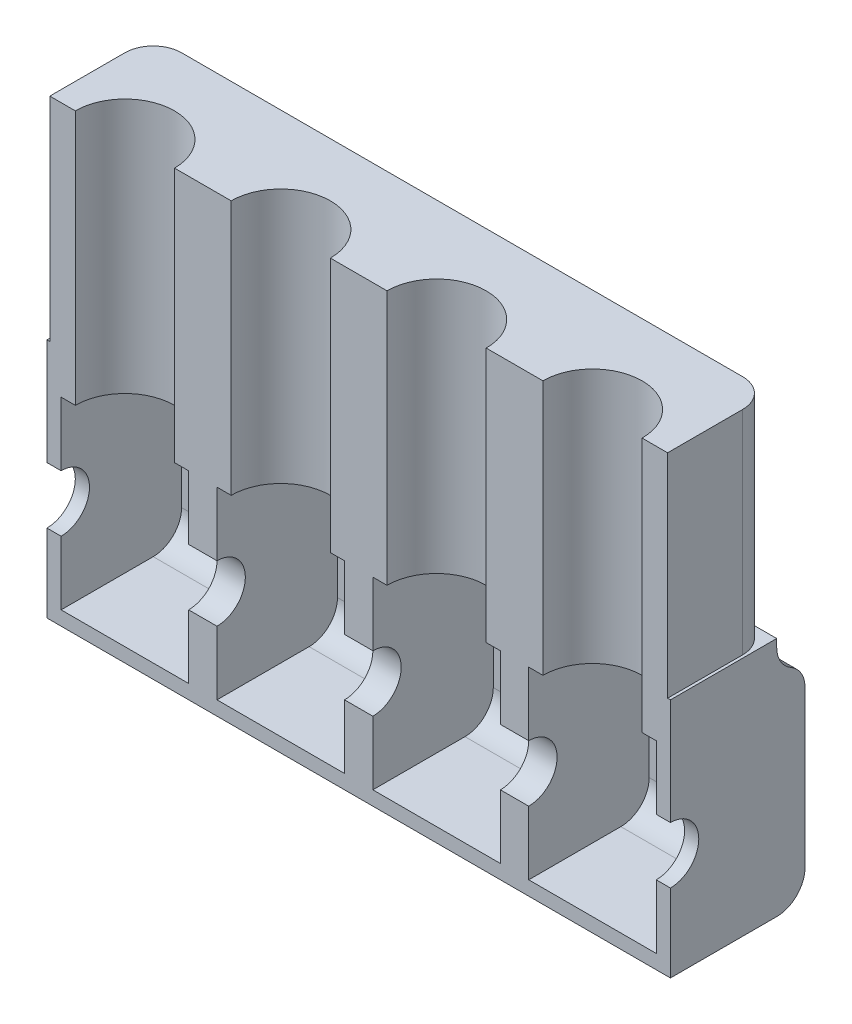
from build123d import *

# Parameters (mm, degrees)
SKETCH5_W              = 55
SKETCH5_H              = 150
BOSS_EXTRUDE3_DEPTH    = 55
SKETCH7_W              = 55
SKETCH7_H              = 27.5
CUT_EXTRUDE5_DEPTH     = 195
SKETCH10_W             = 55
SKETCH10_H             = 150
BOSS_EXTRUDE4_DEPTH    = 10
SKETCH13_W             = 55
SKETCH13_H             = 75
BOSS_EXTRUDE6_DEPTH    = 10
FILLET1_R              = 10
FILLET2_R              = 10
SKETCH15_W             = 45
SKETCH15_H             = 65
CUT_EXTRUDE9_DEPTH     = 42.5
SKETCH6_R              = 17.5
CUT_EXTRUDE11_DEPTH    = 91.5
FILLET3_R              = 10
SKETCH18_R             = 15
SKETCH18_R_2           = 10
BOSS_EXTRUDE7_DEPTH    = 15
CUT_EXTRUDE14_START    = -74
SKETCH20_R             = 10
CUT_EXTRUDE14_DEPTH    = 74
CUT_EXTRUDE16_DEPTH    = 39
CUT_EXTRUDE18_START    = -15
CUT_EXTRUDE18_DEPTH    = 15
FILLET1_OF_MIRROR11_R  = 10
FILLET2_OF_MIRROR11_R  = 10
FILLET3_OF_MIRROR11_R  = 10
CUT_EXTRUDE19_DEPTH    = 15
CUT_EXTRUDE20_START    = -10
CUT_EXTRUDE20_DEPTH    = 10
MIRROR31_START         = 155
MIRROR31_DEPTH         = 65
MIRROR31_START_2       = 110
MIRROR31_2_DEPTH       = 10
MIRROR31_START_3       = 160
MIRROR31_3_DEPTH       = 10
MIRROR31_4_DEPTH       = 5
MIRROR31_START_4       = 215
MIRROR31_5_DEPTH       = 5
MIRROR31_START_5       = 150
MIRROR31_6_OUTLINE_R   = 15
MIRROR31_6_OUTLINE_R_2 = 10
MIRROR31_6_DEPTH       = 15
MIRROR31_START_6       = 120
MIRROR31_7_DEPTH       = 35
MIRROR31_START_7       = -80
MIRROR31_8_DEPTH       = 80
CUT_EXTRUDE22_START    = -36
CUT_EXTRUDE22_DEPTH    = 36
CUT_EXTRUDE23_DEPTH    = 10
SKETCH40_W             = 1
SKETCH40_H             = 36.5
CUT_EXTRUDE25_DEPTH    = 65
FILLET4_R              = 10
BOSS_EXTRUDE8_DEPTH    = 10


with BuildPart() as part:
    # Sketch5 → Boss-Extrude3 (new body)
    with BuildSketch(Plane.XY):
        with Locations((27.5, -75)):
            Rectangle(SKETCH5_W, SKETCH5_H)
    boss_extrude3 = extrude(amount=BOSS_EXTRUDE3_DEPTH)

    # Sketch7 → Cut-Extrude5 (cut)
    with BuildSketch(Plane(origin=(0, 0, 0), x_dir=(1, 0, 0), z_dir=(0, 1, 0))):
        with Locations((27.5, -41.25)):
            Rectangle(SKETCH7_W, SKETCH7_H)
    cut_extrude5 = extrude(amount=-CUT_EXTRUDE5_DEPTH, mode=Mode.SUBTRACT)

    # Sketch10 → Boss-Extrude4 (add)
    with BuildSketch(Plane(origin=(0, 0, 0), x_dir=(-1, 0, 0), z_dir=(0, 0, -1))):
        with Locations((-27.5, -75)):
            Rectangle(SKETCH10_W, SKETCH10_H)
    boss_extrude4 = extrude(amount=BOSS_EXTRUDE4_DEPTH)

    # Sketch13 → Boss-Extrude6 (add)
    with BuildSketch(Plane(origin=(0, 0, -10), x_dir=(-1, 0, 0), z_dir=(0, 0, -1))):
        with Locations((-27.5, -112.5)):
            Rectangle(SKETCH13_W, SKETCH13_H)
    boss_extrude6 = extrude(amount=BOSS_EXTRUDE6_DEPTH)

    # Fillet1
    fillet1_edges = [part.edges().sort_by_distance(p)[0] for p in [
        (27.5, -150, -20),
        (27.5, -75, -20),
    ]]
    fillet(fillet1_edges, radius=FILLET1_R - 0.0001)  # a hair under: the kernel refuses the full size

    # Fillet2
    fillet2_edges = [part.edges().sort_by_distance(p)[0] for p in [
        (27.5, -75, -10),
    ]]
    fillet(fillet2_edges, radius=FILLET2_R)

    # Sketch15 → Cut-Extrude9 (cut)
    with BuildSketch(Plane.XY.offset(27.5)):
        with Locations((27.5, -112.5)):
            Rectangle(SKETCH15_W, SKETCH15_H)
    cut_extrude9 = extrude(amount=-CUT_EXTRUDE9_DEPTH, mode=Mode.SUBTRACT)

    # Sketch6 → Cut-Extrude11 (cut)
    with BuildSketch(Plane(origin=(0, 0, 0), x_dir=(1, 0, 0), z_dir=(0, 1, 0))):
        with Locations((27.5, -27.5)):
            Circle(SKETCH6_R)
    cut_extrude11 = extrude(amount=-CUT_EXTRUDE11_DEPTH, mode=Mode.SUBTRACT)

    # Fillet3
    fillet3_edges = [part.edges().sort_by_distance(p)[0] for p in [
        (27.5, -145, -15),
        (27.5, -80, -15),
    ]]
    fillet(fillet3_edges, radius=FILLET3_R)

    # Sketch18 → Boss-Extrude7 (add)
    with BuildSketch(Plane(origin=(55, 0, 0), x_dir=(0, 0, -1), z_dir=(1, 0, 0))):
        with Locations(Location((-27.5, -112.5, 0), (0, 0, 90))):
            Circle(SKETCH18_R)
        with Locations(Location((-27.5, -112.5, 0), (0, 0, 90))):
            Circle(SKETCH18_R_2, mode=Mode.SUBTRACT)
    boss_extrude7 = extrude(amount=BOSS_EXTRUDE7_DEPTH)

    # Sketch20 → Cut-Extrude14 (cut)
    with BuildSketch(Plane(origin=(55, 0, 0), x_dir=(0, 0, -1), z_dir=(1, 0, 0)).offset(CUT_EXTRUDE14_START)):
        with Locations(Location((-27.5, -112.5, 0), (0, 0, 90))):
            Circle(SKETCH20_R)
    cut_extrude14 = extrude(amount=CUT_EXTRUDE14_DEPTH, mode=Mode.SUBTRACT)

    # Sketch31 → Cut-Extrude16 (cut)
    with BuildSketch(Plane.ZY.offset(-55)):
        with BuildLine():
            Line((27.5, -97.5), (27.5, -102.5))
            ThreePointArc((27.5, -102.5), (37.5, -112.5), (27.5, -122.5))
            Line((27.5, -122.5), (27.5, -127.5))
            ThreePointArc((27.5, -127.5), (42.5, -112.5), (27.5, -97.5))
        make_face()
    extrude(amount=-CUT_EXTRUDE16_DEPTH, mode=Mode.SUBTRACT)

    # Sketch33 → Cut-Extrude18 (cut)
    with BuildSketch(Plane(origin=(70, 0, 0), x_dir=(0, 0, -1), z_dir=(1, 0, 0)).offset(CUT_EXTRUDE18_START)):
        with BuildLine():
            Line((-27.5, -97.5), (-27.5, -102.5))
            ThreePointArc((-27.5, -102.5), (-17.5, -112.5), (-27.5, -122.5))
            Line((-27.5, -122.5), (-27.5, -127.5))
            ThreePointArc((-27.5, -127.5), (-12.5, -112.5), (-27.5, -97.5))
        make_face()
    extrude(amount=CUT_EXTRUDE18_DEPTH, mode=Mode.SUBTRACT)


with BuildPart() as mirror11_1:
    # Mirror11: Boss-Extrude3 across plane
    add(boss_extrude3.mirror(Plane(origin=(55, 0, 0), x_dir=(0, 0, 1), z_dir=(1, 0, 0))))

    # Mirror11 2: Cut-Extrude5 across plane
    add(cut_extrude5.mirror(Plane(origin=(55, 0, 0), x_dir=(0, 0, 1), z_dir=(1, 0, 0))), mode=Mode.SUBTRACT)


with BuildPart() as mirror11_3_1:
    # Mirror11 3: Boss-Extrude4, Boss-Extrude6 across plane
    add(boss_extrude4.mirror(Plane(origin=(55, 0, 0), x_dir=(0, 0, 1), z_dir=(1, 0, 0))))
    add(boss_extrude6.mirror(Plane(origin=(55, 0, 0), x_dir=(0, 0, 1), z_dir=(1, 0, 0))))


with BuildPart() as mirror11_4_tool:
    # Mirror11 4: Cut-Extrude9, Cut-Extrude11 across plane
    add(cut_extrude9.mirror(Plane(origin=(55, 0, 0), x_dir=(0, 0, 1), z_dir=(1, 0, 0))))
    add(cut_extrude11.mirror(Plane(origin=(55, 0, 0), x_dir=(0, 0, 1), z_dir=(1, 0, 0))))


with BuildPart() as mirror11_1_1:
    add(mirror11_1.part)

    # Mirror11 4: cut by mirror11_4_tool
    add(mirror11_4_tool.part, mode=Mode.SUBTRACT)

    # Mirror11 6: Cut-Extrude14 across plane
    add(cut_extrude14.mirror(Plane(origin=(55, 0, 0), x_dir=(0, 0, 1), z_dir=(1, 0, 0))), mode=Mode.SUBTRACT)


with BuildPart() as mirror11_3_1_1:
    add(mirror11_3_1.part)

    # Mirror11 4: cut by mirror11_4_tool
    add(mirror11_4_tool.part, mode=Mode.SUBTRACT)

    # Fillet1 of Mirror11
    fillet1_of_mirror11_edges = [mirror11_3_1_1.edges().sort_by_distance(p)[0] for p in [
        (82.5, -150, -20),
        (82.5, -75, -20),
    ]]
    fillet(fillet1_of_mirror11_edges, radius=FILLET1_OF_MIRROR11_R - 0.0001)  # a hair under: the kernel refuses the full size

    # Fillet2 of Mirror11
    fillet2_of_mirror11_edges = [mirror11_3_1_1.edges().sort_by_distance(p)[0] for p in [
        (82.5, -75, -10),
    ]]
    fillet(fillet2_of_mirror11_edges, radius=FILLET2_OF_MIRROR11_R)

    # Fillet3 of Mirror11
    fillet3_of_mirror11_edges = [mirror11_3_1_1.edges().sort_by_distance(p)[0] for p in [
        (82.5, -145, -15),
        (82.5, -80, -15),
    ]]
    fillet(fillet3_of_mirror11_edges, radius=FILLET3_OF_MIRROR11_R)


with BuildPart() as mirror11_5_1:
    # Mirror11 5: Boss-Extrude7 across plane
    add(boss_extrude7.mirror(Plane(origin=(55, 0, 0), x_dir=(0, 0, 1), z_dir=(1, 0, 0))))


with BuildPart() as part_1:
    add(part.part)

    # Mirror11 united with what the copies tou: union Mirror11_1, Mirror11 3_1, Mirror11 5_1
    add(mirror11_1_1.part)
    add(mirror11_3_1_1.part)
    add(mirror11_5_1.part)

    # Sketch34 → Cut-Extrude19 (cut)
    with BuildSketch(Plane(origin=(55, 0, 0), x_dir=(0, 0, -1), z_dir=(1, 0, 0))):
        with BuildLine():
            Line((-27.5, -97.5), (-27.5, -102.5))
            ThreePointArc((-27.5, -102.5), (-37.5, -112.5), (-27.5, -122.5))
            Line((-27.5, -122.5), (-27.5, -127.5))
            ThreePointArc((-27.5, -127.5), (-42.5, -112.5), (-27.5, -97.5))
        make_face()
    extrude(amount=-CUT_EXTRUDE19_DEPTH, mode=Mode.SUBTRACT)

    # Sketch36 → Cut-Extrude20 (cut)
    with BuildSketch(Plane.ZY.offset(-40).offset(CUT_EXTRUDE20_START)):
        with BuildLine():
            Line((27.5, -97.5), (27.5, -102.5))
            ThreePointArc((27.5, -102.5), (17.5, -112.5), (27.5, -122.5))
            Line((27.5, -122.5), (27.5, -127.5))
            ThreePointArc((27.5, -127.5), (12.5, -112.5), (27.5, -97.5))
        make_face()
    extrude(amount=CUT_EXTRUDE20_DEPTH, mode=Mode.SUBTRACT)

    # Mirror31 2 outline → Mirror31 2 (add)
    with BuildSketch(Plane.YZ.offset(MIRROR31_START_2)):
        with BuildLine():
            Line((-145, 27.5), (-150, 27.5))
            Line((-150, 27.5), (-150, -10))
            ThreePointArc((-150, -10), (-147.071067812, -17.071067812), (-140, -20))
            Line((-140, -20), (-85, -20))
            ThreePointArc((-85, -20), (-80, -18.660254038), (-76.339745962, -15))
            ThreePointArc((-76.339745962, -15), (-72.679491924, -11.339745962), (-67.679491924, -10))
            Line((-67.679491924, -10), (0, -10))
            Line((0, -10), (0, 27.5))
            Line((0, 27.5), (-80, 27.5))
            Line((-80, 27.5), (-80, -5))
            ThreePointArc((-80, -5), (-82.928932188, -12.071067812), (-90, -15))
            Line((-90, -15), (-135, -15))
            ThreePointArc((-135, -15), (-142.071067812, -12.071067812), (-145, -5))
            Line((-145, -5), (-145, 27.5))
        make_face()
    extrude(amount=MIRROR31_2_DEPTH)

    # Mirror31 4 outline → Mirror31 4 (add)
    with BuildSketch(Plane.YZ.offset(MIRROR31_START_2)):
        with BuildLine():
            Line((-145, 27.5), (-145, -5))
            ThreePointArc((-145, -5), (-142.071067812, -12.071067812), (-135, -15))
            Line((-135, -15), (-90, -15))
            ThreePointArc((-90, -15), (-82.928932188, -12.071067812), (-80, -5))
            Line((-80, -5), (-80, 27.5))
            Line((-80, 27.5), (-102.5, 27.5))
            ThreePointArc((-102.5, 27.5), (-112.5, 17.5), (-122.5, 27.5))
            Line((-122.5, 27.5), (-145, 27.5))
        make_face()
    extrude(amount=MIRROR31_4_DEPTH)



with BuildPart() as body_2:
    # Mirror31: read off the stored shape, not the designer's step
    # Mirror31 outline → Mirror31 (new body)
    with BuildSketch(Plane.YZ.offset(MIRROR31_START)):
        with BuildLine():
            Line((-145, 27.5), (-150, 27.5))
            Line((-150, 27.5), (-150, -10))
            ThreePointArc((-150, -10), (-147.071067812, -17.071067812), (-140, -20))
            Line((-140, -20), (-85, -20))
            ThreePointArc((-85, -20), (-80, -18.660254038), (-76.339745962, -15))
            ThreePointArc((-76.339745962, -15), (-72.679491924, -11.339745962), (-67.679491924, -10))
            Line((-67.679491924, -10), (0, -10))
            Line((0, -10), (0, 27.5))
            Line((0, 27.5), (-80, 27.5))
            Line((-80, 27.5), (-80, -5))
            ThreePointArc((-80, -5), (-82.928932188, -12.071067812), (-90, -15))
            Line((-90, -15), (-135, -15))
            ThreePointArc((-135, -15), (-142.071067812, -12.071067812), (-145, -5))
            Line((-145, -5), (-145, 27.5))
        make_face()
    extrude(amount=MIRROR31_DEPTH)

    # Mirror31 3 outline → Mirror31 3 (add)
    with BuildSketch(Plane.YZ.offset(MIRROR31_START_3)):
        with BuildLine():
            Line((-145, 27.5), (-145, -5))
            ThreePointArc((-145, -5), (-142.071067812, -12.071067812), (-135, -15))
            Line((-135, -15), (-90, -15))
            ThreePointArc((-90, -15), (-82.928932188, -12.071067812), (-80, -5))
            Line((-80, -5), (-80, 27.5))
            Line((-80, 27.5), (-102.5, 27.5))
            ThreePointArc((-102.5, 27.5), (-112.5, 17.5), (-122.5, 27.5))
            Line((-122.5, 27.5), (-145, 27.5))
        make_face()
    extrude(amount=MIRROR31_3_DEPTH)

    # Mirror31 5 outline → Mirror31 5 (add)
    with BuildSketch(Plane.YZ.offset(MIRROR31_START_4)):
        with BuildLine():
            Line((-145, 27.5), (-145, -5))
            ThreePointArc((-145, -5), (-142.071067812, -12.071067812), (-135, -15))
            Line((-135, -15), (-90, -15))
            ThreePointArc((-90, -15), (-82.928932188, -12.071067812), (-80, -5))
            Line((-80, -5), (-80, 27.5))
            Line((-80, 27.5), (-102.5, 27.5))
            ThreePointArc((-102.5, 27.5), (-112.5, 17.5), (-122.5, 27.5))
            Line((-122.5, 27.5), (-145, 27.5))
        make_face()
    extrude(amount=MIRROR31_5_DEPTH)

    # Mirror31 6 outline → Mirror31 6 (add)
    with BuildSketch(Plane.YZ.offset(MIRROR31_START_5)):
        with Locations((-112.5, 27.5)):
            Circle(MIRROR31_6_OUTLINE_R)
        with Locations((-112.5, 27.5)):
            Circle(MIRROR31_6_OUTLINE_R_2, mode=Mode.SUBTRACT)
    extrude(amount=MIRROR31_6_DEPTH)


with BuildPart() as part_2:
    add(part_1.part)

    add(body_2.part)  # Mirror31 7 merges body 2
    # Mirror31 7 outline → Mirror31 7 (add)
    with BuildSketch(Plane.YZ.offset(MIRROR31_START_6)):
        with BuildLine():
            Line((-145, 27.5), (-150, 27.5))
            Line((-150, 27.5), (-150, -10))
            ThreePointArc((-150, -10), (-147.071067812, -17.071067812), (-140, -20))
            Line((-140, -20), (-85, -20))
            ThreePointArc((-85, -20), (-80, -18.660254038), (-76.339745962, -15))
            ThreePointArc((-76.339745962, -15), (-72.679491924, -11.339745962), (-67.679491924, -10))
            Line((-67.679491924, -10), (0, -10))
            Line((0, -10), (0, 27.5))
            Line((0, 27.5), (-80, 27.5))
            Line((-80, 27.5), (-80, -5))
            ThreePointArc((-80, -5), (-82.928932188, -12.071067812), (-90, -15))
            Line((-90, -15), (-135, -15))
            ThreePointArc((-135, -15), (-142.071067812, -12.071067812), (-145, -5))
            Line((-145, -5), (-145, 27.5))
        make_face()
    extrude(amount=MIRROR31_7_DEPTH)

    # Mirror31 8 outline → Mirror31 8 (cut)
    with BuildSketch(Plane(origin=(0, 0, 0), x_dir=(1, 0, 0), z_dir=(0, 1, 0)).offset(MIRROR31_START_7)):
        with BuildLine():
            Line((120, -27.5), (155, -27.5))
            ThreePointArc((155, -27.5), (137.5, -10), (120, -27.5))
        make_face()
    extrude(amount=MIRROR31_8_DEPTH, mode=Mode.SUBTRACT)

    # Mirror32: Cut-Extrude11 across plane
    add(cut_extrude11.mirror(Plane(origin=(110, 0, 0), x_dir=(0, 0, 1), z_dir=(1, 0, 0))), mode=Mode.SUBTRACT)

    # Sketch38 → Cut-Extrude22 (cut)
    with BuildSketch(Plane(origin=(165, 0, 0), x_dir=(0, 0, -1), z_dir=(1, 0, 0)).offset(CUT_EXTRUDE22_START)):
        with BuildLine():
            Line((-27.5, -97.5), (-27.5, -102.5))
            ThreePointArc((-27.5, -102.5), (-37.5, -112.5), (-27.5, -122.5))
            Line((-27.5, -122.5), (-27.5, -127.5))
            ThreePointArc((-27.5, -127.5), (-42.5, -112.5), (-27.5, -97.5))
        make_face()
    extrude(amount=CUT_EXTRUDE22_DEPTH, mode=Mode.SUBTRACT)

    # Sketch39 → Cut-Extrude23 (cut)
    with BuildSketch(Plane.ZY.offset(-150)):
        with BuildLine():
            Line((27.5, -97.5), (27.5, -102.5))
            ThreePointArc((27.5, -102.5), (17.5, -112.5), (27.5, -122.5))
            Line((27.5, -122.5), (27.5, -127.5))
            ThreePointArc((27.5, -127.5), (12.5, -112.5), (27.5, -97.5))
        make_face()
    extrude(amount=-CUT_EXTRUDE23_DEPTH, mode=Mode.SUBTRACT)

    # Sketch40 → Cut-Extrude25 (cut)
    with BuildSketch(Plane(origin=(0, 0, 0), x_dir=(1, 0, 0), z_dir=(0, 1, 0))):
        Polygon((1, 10), (1, 9), (219, 9), (220, 9), (220, 10), align=None)
        Polygon((0, 7.192873083), (0, -27.5), (1, -27.5), (1, 9), (1, 10), (0, 10), align=None)
        with Locations((219.5, -9.25)):
            Rectangle(SKETCH40_W, SKETCH40_H)
    extrude(amount=-CUT_EXTRUDE25_DEPTH, mode=Mode.SUBTRACT)

    # Fillet4
    fillet4_edges = [part_2.edges().sort_by_distance(p)[0] for p in [
        (219, -32.5, -9),
        (1, -32.5, -9),
    ]]
    fillet(fillet4_edges, radius=FILLET4_R)

    # Sketch41 → Boss-Extrude8 (add)
    with BuildSketch(Plane(origin=(0, 0, 0), x_dir=(1, 0, 0), z_dir=(0, 1, 0))):
        with BuildLine():
            Line((1, -27.5), (1, -1))
            ThreePointArc((1, -1), (3.928932188, 6.071067812), (11, 9))
            Line((11, 9), (209, 9))
            ThreePointArc((209, 9), (216.071067812, 6.071067812), (219, -1))
            Line((219, -1), (219, -27.5))
            Line((219, -27.5), (210, -27.5))
            ThreePointArc((210, -27.5), (192.5, -10), (175, -27.5))
            Line((175, -27.5), (155, -27.5))
            ThreePointArc((155, -27.5), (137.5, -10), (120, -27.5))
            Line((120, -27.5), (100, -27.5))
            ThreePointArc((100, -27.5), (82.5, -10), (65, -27.5))
            Line((65, -27.5), (45, -27.5))
            ThreePointArc((45, -27.5), (27.5, -10), (10, -27.5))
            Line((10, -27.5), (1, -27.5))
        make_face()
    extrude(amount=BOSS_EXTRUDE8_DEPTH)


solid = part_2.part
